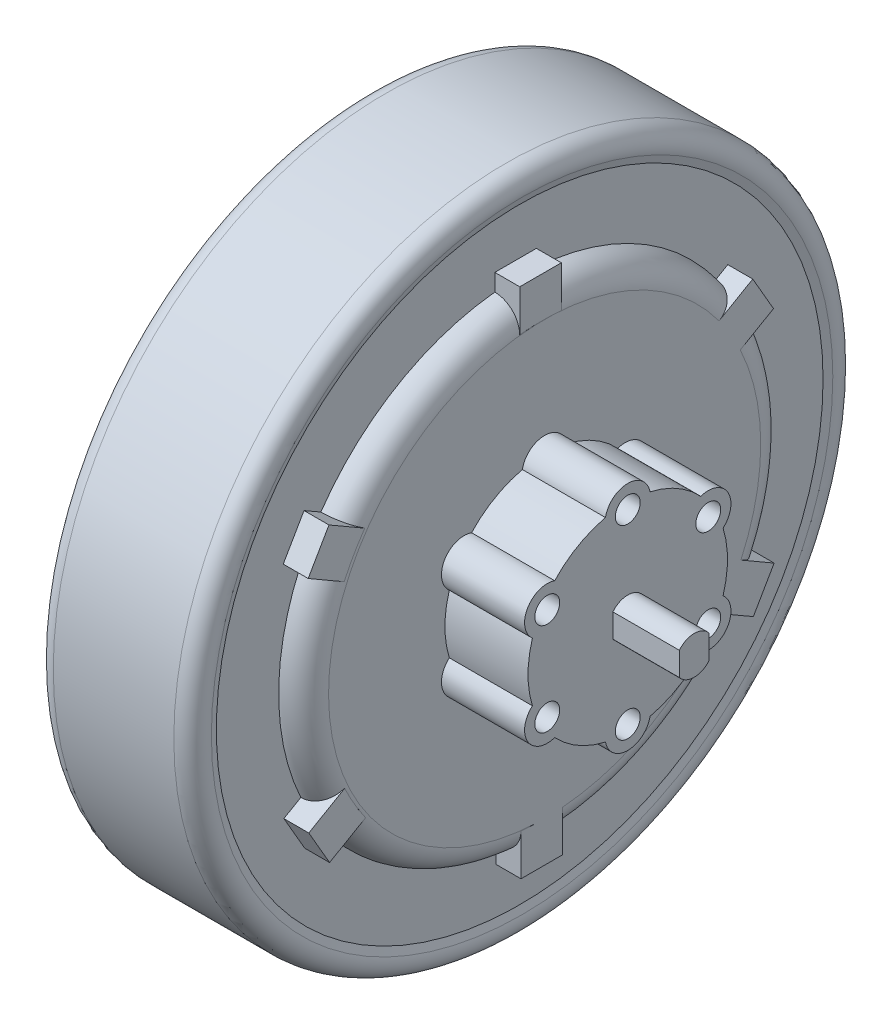
from build123d import *

# Parameters (mm, degrees)
FILLET1_R               = 7.62
BOSS_EXTRUDE1_REACH     = 176.614
BOSS_EXTRUDE2_REACH     = 180.854
SKETCH8_R               = 3.81
CUT_EXTRUDE1_DEPTH      = 10.16
BOSS_EXTRUDE3_START     = -30.48
BOSS_EXTRUDE3_DEPTH     = 50.8
FILLET2_R               = 5.08
CUT_EXTRUDE2_DEPTH      = 171.006870865
CUT_EXTRUDE2_DEPTH_BACK = 171.006870865
SKETCH10_W              = 27.432
SKETCH10_H              = 23.859417876


with BuildPart() as part:
    # Sketch1 → Revolve1 (revolve)
    with BuildSketch(Plane(origin=(0, 0, 0), x_dir=(1, 0, 0), z_dir=(0, 1, 0))):
        Polygon((-25.4, 89.957651553), (25.4, 89.957651553), (22.52795133, 81.067651553), (22.52795133, 62.017651553), (30.14795133, 62.017651553), (30.14795133, 18.837651553), (55.54795133, 18.837651553), (55.54795133, -11.642348447), (27.916105003, -11.642348447), (-27.916105003, -11.642348447), (-30.14795133, -11.642348447), (-36.538387274, -11.642348447), (-38.485282563, -11.642348447), (-38.485282563, -4.569560668), (-36.538387274, -4.569560668), (-36.538387274, -2.752348447), (-30.188387274, -2.752348447), (-30.14795133, 18.837651553), (-30.14795133, 62.017651553), (-22.52795133, 62.017651553), (-22.52795133, 81.067651553), align=None)
    revolve(axis=Axis((27.916105003, 0, 11.642348447), (-1, 0, 0)))

    # Fillet1
    fillet1_edges = [part.edges().sort_by_distance(p)[0] for p in [
        (30.14795133, 0, 85.302348447),
        (-30.14795133, 0, 85.302348447),
    ]]
    fillet(fillet1_edges, radius=FILLET1_R - 0.0001)  # a hair under: the kernel refuses the full size

    # Sketch3 → Boss-Extrude1 (add, up to next)
    with BuildSketch(Plane.ZY.offset(30.14795133), mode=Mode.PRIVATE) as boss_extrude1_sk1:
        with BuildLine():
            Line((6.548079435, 65.848079987), (6.548079435, 78.481902205))
            Line((6.548079435, 78.481902205), (19.248079435, 78.481902205))
            Line((19.248079435, 78.481902205), (19.248079435, 65.781902205))
            ThreePointArc((19.248079435, 65.781902205), (12.899508359, 66.08921215), (6.548079435, 65.848079987))
        make_face()
    boss_extrude1_tool1 = extrude(boss_extrude1_sk1.sketch, amount=-BOSS_EXTRUDE1_REACH, mode=Mode.PRIVATE) - part.part
    # Sketch3 → Boss-Extrude1 (add, up to next)
    with BuildSketch(Plane.ZY.offset(30.14795133), mode=Mode.PRIVATE) as boss_extrude1_sk2:
        with BuildLine():
            Line((83.905715987, 33.598728719), (72.907193358, 27.248728719))
            ThreePointArc((72.907193358, 27.248728719), (69.99904604, 32.900407521), (66.614504999, 38.280340238))
            Line((66.614504999, 38.280340238), (77.555715987, 44.597251347))
            Line((77.555715987, 44.597251347), (83.905715987, 33.598728719))
        make_face()
    boss_extrude1_tool2 = extrude(boss_extrude1_sk2.sketch, amount=-BOSS_EXTRUDE1_REACH, mode=Mode.PRIVATE) - part.part
    # Sketch3 → Boss-Extrude1 (add, up to next)
    with BuildSketch(Plane.ZY.offset(30.14795133), mode=Mode.PRIVATE) as boss_extrude1_sk3:
        with BuildLine():
            Line((77.364565821, -44.838013826), (66.366043193, -38.488013826))
            ThreePointArc((66.366043193, -38.488013826), (69.80646695, -33.14364497), (72.773354834, -27.522580089))
            Line((72.773354834, -27.522580089), (83.714565821, -33.839491198))
            Line((83.714565821, -33.839491198), (77.364565821, -44.838013826))
        make_face()
    boss_extrude1_tool3 = extrude(boss_extrude1_sk3.sketch, amount=-BOSS_EXTRUDE1_REACH, mode=Mode.PRIVATE) - part.part
    # Sketch3 → Boss-Extrude1 (add, up to next)
    with BuildSketch(Plane.ZY.offset(30.14795133), mode=Mode.PRIVATE) as boss_extrude1_sk4:
        with BuildLine():
            Line((6.165779104, -78.391582886), (6.165779104, -65.691582886))
            ThreePointArc((6.165779104, -65.691582886), (12.51435018, -65.998892831), (18.865779104, -65.757760668))
            Line((18.865779104, -65.757760668), (18.865779104, -78.391582886))
            Line((18.865779104, -78.391582886), (6.165779104, -78.391582886))
        make_face()
    boss_extrude1_tool4 = extrude(boss_extrude1_sk4.sketch, amount=-BOSS_EXTRUDE1_REACH, mode=Mode.PRIVATE) - part.part
    # Sketch3 → Boss-Extrude1 (add, up to next)
    with BuildSketch(Plane.ZY.offset(30.14795133), mode=Mode.PRIVATE) as boss_extrude1_sk5:
        with BuildLine():
            Line((-58.491857447, -33.5084094), (-47.493334819, -27.1584094))
            ThreePointArc((-47.493334819, -27.1584094), (-44.585187501, -32.810088202), (-41.20064646, -38.190020919))
            Line((-41.20064646, -38.190020919), (-52.141857447, -44.506932028))
            Line((-52.141857447, -44.506932028), (-58.491857447, -33.5084094))
        make_face()
    boss_extrude1_tool5 = extrude(boss_extrude1_sk5.sketch, amount=-BOSS_EXTRUDE1_REACH, mode=Mode.PRIVATE) - part.part
    # Sketch3 → Boss-Extrude1 (add, up to next)
    with BuildSketch(Plane.ZY.offset(30.14795133), mode=Mode.PRIVATE) as boss_extrude1_sk6:
        with BuildLine():
            Line((-51.950707282, 44.928333145), (-40.952184654, 38.578333145))
            ThreePointArc((-40.952184654, 38.578333145), (-44.392608411, 33.233964289), (-47.359496295, 27.612899408))
            Line((-47.359496295, 27.612899408), (-58.300707282, 33.929810517))
            Line((-58.300707282, 33.929810517), (-51.950707282, 44.928333145))
        make_face()
    boss_extrude1_tool6 = extrude(boss_extrude1_sk6.sketch, amount=-BOSS_EXTRUDE1_REACH, mode=Mode.PRIVATE) - part.part
    boss_extrude1_1 = boss_extrude1_tool1.solids().sort_by_distance((-30.147951, 72.239608, 12.903681))[0]
    add(boss_extrude1_1)
    boss_extrude1_2 = boss_extrude1_tool2.solids().sort_by_distance((-30.147951, 35.971992, 75.327532))[0]
    add(boss_extrude1_2)
    boss_extrude1_3 = boss_extrude1_tool3.solids().sort_by_distance((-30.147951, -36.222457, 75.13078))[0]
    add(boss_extrude1_3)
    boss_extrude1_4 = boss_extrude1_tool4.solids().sort_by_distance((-30.147951, -72.149289, 12.510177))[0]
    add(boss_extrude1_4)
    boss_extrude1_5 = boss_extrude1_tool5.solids().sort_by_distance((-30.147951, -35.881672, -49.913673))[0]
    add(boss_extrude1_5)
    boss_extrude1_6 = boss_extrude1_tool6.solids().sort_by_distance((-30.147951, 36.312776, -49.716921))[0]
    add(boss_extrude1_6)
    boss_extrude1 = boss_extrude1_1 + boss_extrude1_2 + boss_extrude1_3 + boss_extrude1_4 + boss_extrude1_5 + boss_extrude1_6  # Boss-Extrude1 as one shape, for the pattern or mirror that repeats it

    # Mirror1: Boss-Extrude1 across plane
    add(boss_extrude1.mirror(Plane(origin=(0, 0, 0), x_dir=(0, 0, 1), z_dir=(1, 0, 0))))

    # Sketch7 → Boss-Extrude2 (add, up to next)
    with BuildSketch(Plane(origin=(55.54795133, 0, 0), x_dir=(0, 0, -1), z_dir=(1, 0, 0)), mode=Mode.PRIVATE) as boss_extrude2_sk1:
        with BuildLine():
            ThreePointArc((-18.451009464, 29.709805371), (-11.642348447, 35.336889159), (-4.833687431, 29.709805371))
            ThreePointArc((-4.833687431, 29.709805371), (-11.642348447, 30.48), (-18.451009464, 29.709805371))
        make_face()
    boss_extrude2_tool1 = extrude(boss_extrude2_sk1.sketch, amount=-BOSS_EXTRUDE2_REACH, mode=Mode.PRIVATE) - part.part
    # Sketch7 → Boss-Extrude2 (add, up to next)
    with BuildSketch(Plane(origin=(55.54795133, 0, 0), x_dir=(0, 0, -1), z_dir=(1, 0, 0)), mode=Mode.PRIVATE) as boss_extrude2_sk2:
        with BuildLine():
            ThreePointArc((10.682767237, 20.751376091), (14.75410586, 15.24), (17.491428253, 8.95842928))
            ThreePointArc((17.491428253, 8.95842928), (18.960295255, 17.66844458), (10.682767237, 20.751376091))
        make_face()
    boss_extrude2_tool2 = extrude(boss_extrude2_sk2.sketch, amount=-BOSS_EXTRUDE2_REACH, mode=Mode.PRIVATE) - part.part
    # Sketch7 → Boss-Extrude2 (add, up to next)
    with BuildSketch(Plane(origin=(55.54795133, 0, 0), x_dir=(0, 0, -1), z_dir=(1, 0, 0)), mode=Mode.PRIVATE) as boss_extrude2_sk3:
        with BuildLine():
            ThreePointArc((17.491428253, -8.95842928), (14.75410586, -15.24), (10.682767237, -20.751376091))
            ThreePointArc((10.682767237, -20.751376091), (18.960295255, -17.66844458), (17.491428253, -8.95842928))
        make_face()
    boss_extrude2_tool3 = extrude(boss_extrude2_sk3.sketch, amount=-BOSS_EXTRUDE2_REACH, mode=Mode.PRIVATE) - part.part
    # Sketch7 → Boss-Extrude2 (add, up to next)
    with BuildSketch(Plane(origin=(55.54795133, 0, 0), x_dir=(0, 0, -1), z_dir=(1, 0, 0)), mode=Mode.PRIVATE) as boss_extrude2_sk4:
        with BuildLine():
            ThreePointArc((-4.833687431, -29.709805371), (-11.642348447, -30.48), (-18.451009464, -29.709805371))
            ThreePointArc((-18.451009464, -29.709805371), (-11.642348447, -35.336889159), (-4.833687431, -29.709805371))
        make_face()
    boss_extrude2_tool4 = extrude(boss_extrude2_sk4.sketch, amount=-BOSS_EXTRUDE2_REACH, mode=Mode.PRIVATE) - part.part
    # Sketch7 → Boss-Extrude2 (add, up to next)
    with BuildSketch(Plane(origin=(55.54795133, 0, 0), x_dir=(0, 0, -1), z_dir=(1, 0, 0)), mode=Mode.PRIVATE) as boss_extrude2_sk5:
        with BuildLine():
            ThreePointArc((-33.967464132, -20.751376091), (-38.038802755, -15.24), (-40.776125148, -8.95842928))
            ThreePointArc((-40.776125148, -8.95842928), (-42.24499215, -17.66844458), (-33.967464132, -20.751376091))
        make_face()
    boss_extrude2_tool5 = extrude(boss_extrude2_sk5.sketch, amount=-BOSS_EXTRUDE2_REACH, mode=Mode.PRIVATE) - part.part
    # Sketch7 → Boss-Extrude2 (add, up to next)
    with BuildSketch(Plane(origin=(55.54795133, 0, 0), x_dir=(0, 0, -1), z_dir=(1, 0, 0)), mode=Mode.PRIVATE) as boss_extrude2_sk6:
        with BuildLine():
            ThreePointArc((-40.776125148, 8.95842928), (-38.038802755, 15.24), (-33.967464132, 20.751376091))
            ThreePointArc((-33.967464132, 20.751376091), (-42.24499215, 17.66844458), (-40.776125148, 8.95842928))
        make_face()
    boss_extrude2_tool6 = extrude(boss_extrude2_sk6.sketch, amount=-BOSS_EXTRUDE2_REACH, mode=Mode.PRIVATE) - part.part
    add(boss_extrude2_tool1.solids().sort_by_distance((55.547951, 32.347627, 11.642348))[0])
    add(boss_extrude2_tool2.solids().sort_by_distance((55.547951, 16.173814, -16.371518))[0])
    add(boss_extrude2_tool3.solids().sort_by_distance((55.547951, -16.173814, -16.371518))[0])
    add(boss_extrude2_tool4.solids().sort_by_distance((55.547951, -32.347627, 11.642348))[0])
    add(boss_extrude2_tool5.solids().sort_by_distance((55.547951, -16.173814, 39.656215))[0])
    add(boss_extrude2_tool6.solids().sort_by_distance((55.547951, 16.173814, 39.656215))[0])

    # Sketch8 → Cut-Extrude1 (cut)
    with BuildSketch(Plane(origin=(55.54795133, 0, 0), x_dir=(0, 0, -1), z_dir=(1, 0, 0))):
        with Locations((-11.642348447, 28.404174122)):
            Circle(SKETCH8_R)
        with Locations((12.956387916, 14.202087061)):
            Circle(SKETCH8_R)
        with Locations((12.956387916, -14.202087061)):
            Circle(SKETCH8_R)
        with Locations((-11.642348447, -28.404174122)):
            Circle(SKETCH8_R)
        with Locations((-36.241084811, -14.202087061)):
            Circle(SKETCH8_R)
        with Locations((-36.241084811, 14.202087061)):
            Circle(SKETCH8_R)
    extrude(amount=-CUT_EXTRUDE1_DEPTH, mode=Mode.SUBTRACT)

    # Sketch9 → Boss-Extrude3 (add)
    with BuildSketch(Plane(origin=(55.54795133, 0, 0), x_dir=(0, 0, -1), z_dir=(1, 0, 0)).offset(BOSS_EXTRUDE3_START)):
        with BuildLine():
            Line((-7.095829721, 3.607550787), (-7.095829721, -3.607550787))
            ThreePointArc((-7.095829721, -3.607550787), (-11.642348447, -5.8039), (-16.188867174, -3.607550787))
            Line((-16.188867174, -3.607550787), (-16.188867174, 3.607550787))
            ThreePointArc((-16.188867174, 3.607550787), (-11.642348447, 5.8039), (-7.095829721, 3.607550787))
        make_face()
    boss_extrude3 = extrude(amount=BOSS_EXTRUDE3_DEPTH)

    # Mirror3: Boss-Extrude3 across plane
    add(boss_extrude3.mirror(Plane(origin=(0, 0, 0), x_dir=(0, 0, 1), z_dir=(1, 0, 0))))

    # Fillet2
    fillet2_edges = [part.edges().sort_by_distance(p)[0] for p in [
        (25.4, 0, 113.242348447),
        (-25.4, 0, 113.242348447),
    ]]
    fillet(fillet2_edges, radius=FILLET2_R)

    # Sketch10 → Cut-Extrude2 (cut, two sides: drawn at the far end of the back side and taken through both)
    with BuildSketch(Plane.XY.offset(-CUT_EXTRUDE2_DEPTH_BACK)):
        with Locations((-73.283336896, 2.226879002)):
            Rectangle(SKETCH10_W, SKETCH10_H)
    extrude(amount=CUT_EXTRUDE2_DEPTH + CUT_EXTRUDE2_DEPTH_BACK, mode=Mode.SUBTRACT)


solid = part.part
